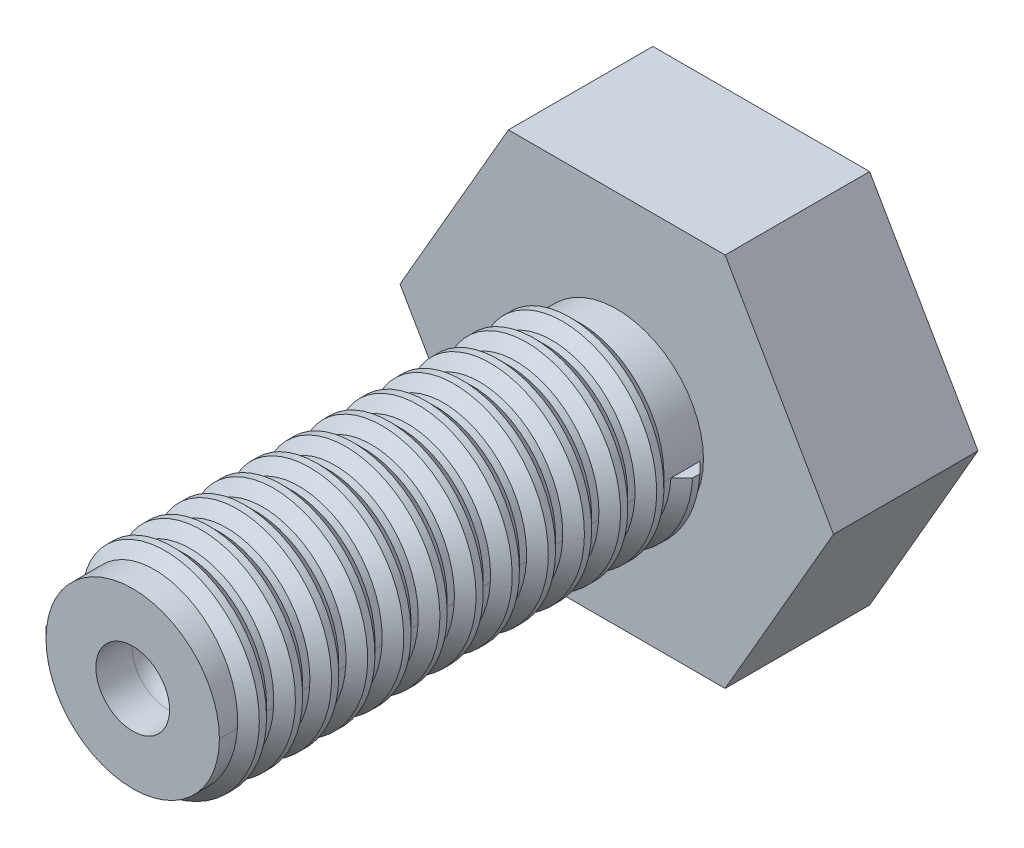
from build123d import *

# Parameters (mm, degrees)
EXTRUDE_1_DEPTH     = 10
SKETCH_2_R          = 6
EXTRUDE_2_DEPTH     = 33.5
SWEEP_1_PITCH       = 2.5
SKETCH_10_R         = 2.55
CUT_EXTRUDE_1_DEPTH = 2.5


with BuildPart() as part:
    # 草图1 → 凸台-拉伸1 (new body)
    with BuildSketch(Plane.XY):
        Polygon((15, 0), (7.5, 12.990381057), (-7.5, 12.990381057), (-15, 0), (-7.5, -12.990381057), (7.5, -12.990381057), align=None)
    extrude(amount=EXTRUDE_1_DEPTH)

    # 草图2 → 凸台-拉伸2 (add)
    with BuildSketch(Plane.XY.offset(10)):
        Circle(SKETCH_2_R)
    extrude(amount=EXTRUDE_2_DEPTH)

    # 扫描1: the profile of 草图4 profile screwed along a left-hand helix of 12.5 turns, 10 arcs to a turn; built about Z, then put on its axis
    sweep_1_z = Axis((0, 0, 0), (0, 0, 1))
    sweep_1_corners = [(5.9997, 0, -1.0003), (5.9997, 0, 1.0003), (6.75, 0, 0.25), (6.75, 0, -0.25)]
    with BuildLine(mode=Mode.PRIVATE) as sweep_1_profile:
        Line(sweep_1_corners[0], sweep_1_corners[1])
        Line(sweep_1_corners[1], sweep_1_corners[2])
        Line(sweep_1_corners[2], sweep_1_corners[3])
        Line(sweep_1_corners[3], sweep_1_corners[0])
    sweep_1_cap = Face(sweep_1_profile.wire())
    sweep_1_turn_angles = [0, -18, -36, -54, -72, -90, -108, -126, -144, -162, -180, -198, -216, -234, -252, -270, -288, -306, -324, -342, -360]
    sweep_1_turn_weights = [1, 0.9510565162951535, 1, 0.9510565162951535, 1, 0.9510565162951535, 1, 0.9510565162951535, 1, 0.9510565162951535, 1, 0.9510565162951535, 1, 0.9510565162951535, 1, 0.9510565162951535, 1, 0.9510565162951535, 1, 0.9510565162951535, 1]
    sweep_1_turn_rails = [Edge.make_bspline([Vector(p[0], p[1], 0).rotate(sweep_1_z, sweep_1_turn_angles[k]) / sweep_1_turn_weights[k] + Vector(0, 0, p[2] + -SWEEP_1_PITCH * sweep_1_turn_angles[k] / 360) for k in range(21)], [0, 0, 0, 1, 1, 2, 2, 3, 3, 4, 4, 5, 5, 6, 6, 7, 7, 8, 8, 9, 9, 10, 10, 10], 2, sweep_1_turn_weights) for p in sweep_1_corners]
    sweep_1_turn_sides = [Face.make_surface_from_curves(sweep_1_turn_rails[p[0]], sweep_1_turn_rails[p[1]]) for p in [(0, 1), (1, 2), (2, 3), (3, 0)]]
    sweep_1_last_angles = [-4320, -4338, -4356, -4374, -4392, -4410, -4428, -4446, -4464, -4482, -4500]
    sweep_1_last_weights = [1, 0.9510565162951535, 1, 0.9510565162951535, 1, 0.9510565162951535, 1, 0.9510565162951535, 1, 0.9510565162951315, 1]
    sweep_1_last_rails = [Edge.make_bspline([Vector(p[0], p[1], 0).rotate(sweep_1_z, sweep_1_last_angles[k]) / sweep_1_last_weights[k] + Vector(0, 0, p[2] + -SWEEP_1_PITCH * sweep_1_last_angles[k] / 360) for k in range(11)], [0, 0, 0, 1, 1, 2, 2, 3, 3, 4, 4, 5, 5, 5], 2, sweep_1_last_weights) for p in sweep_1_corners]
    sweep_1_last_sides = [Face.make_surface_from_curves(sweep_1_last_rails[p[0]], sweep_1_last_rails[p[1]]) for p in [(0, 1), (1, 2), (2, 3), (3, 0)]]
    sweep_1 = Plane(origin=(0, 0, 11.25), x_dir=(1, 0, 0), z_dir=(0, 0, 1)) * Solid(Shell([*[p.moved(Location((0, 0, SWEEP_1_PITCH * i))) for i in range(12) for p in sweep_1_turn_sides], *sweep_1_last_sides, sweep_1_cap, sweep_1_cap.rotate(sweep_1_z, -4500).moved(Location((0, 0, -SWEEP_1_PITCH * -4500 / 360)))]))
    add(sweep_1)

    # 草图10 → 切除-拉伸1 (cut)
    with BuildSketch(Plane.XY.offset(43.5)):
        Circle(SKETCH_10_R)
    extrude(amount=-CUT_EXTRUDE_1_DEPTH, mode=Mode.SUBTRACT)

    # 草图11 → 切除-旋转1 (revolve, cut)
    with BuildSketch(Plane.XY.offset(41)):
        with BuildLine():
            Line((0, 2.55), (0, -2.55))
            ThreePointArc((0, -2.55), (2.55, 0), (0, 2.55))
        make_face()
    revolve(axis=Axis((0, 2.55, 41), (0, -1, 0)), mode=Mode.SUBTRACT)


solid = part.part
